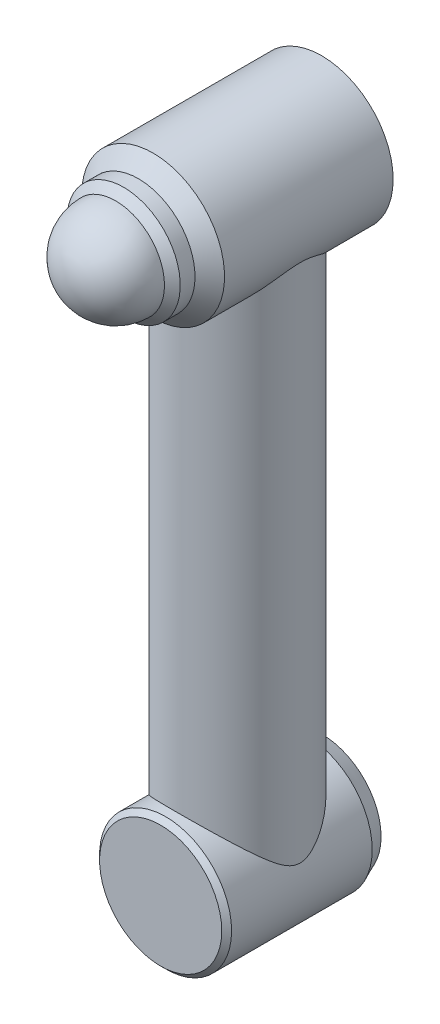
from build123d import *

# Parameters (mm, degrees)
SKETCH1_R                = 72.5
BOSS_EXTRUDE1_DEPTH      = 294
FILLET1_R                = 72.5
SKETCH2_R                = 63.5
BOSS_EXTRUDE2_DEPTH      = 584.2
BOSS_EXTRUDE3_DEPTH      = 78
BOSS_EXTRUDE3_DEPTH_BACK = 85.75
SKETCH3_R                = 67
CHAMFER1_SIZE            = 5
CHAMFER2_SIZE            = 7
CHAMFER2_SIZE2           = 16
SHELL1_3_OUTLINE_W       = 53.5
SHELL1_3_OUTLINE_H       = 532.228338498


with BuildPart() as part:
    # Sketch1 → Boss-Extrude1 (new body)
    with BuildSketch(Plane.XY):
        Circle(SKETCH1_R)
    extrude(amount=BOSS_EXTRUDE1_DEPTH)

    # Fillet1
    fillet1_edges = [part.edges().sort_by_distance(p)[0] for p in [
        (-72.5, 0, 294),
    ]]
    fillet(fillet1_edges, radius=FILLET1_R)

    # Sketch2 → Boss-Extrude2 (add)
    with BuildSketch(Plane(origin=(0, 0, 0), x_dir=(1, 0, 0), z_dir=(0, 1, 0))):
        with Locations(Location((0, -85.5, 0), (0, 0, 270))):
            Circle(SKETCH2_R)
    extrude(amount=-BOSS_EXTRUDE2_DEPTH)

    # Sketch3 → Boss-Extrude3 (add, two sides: drawn at the far end of the back side and taken through both)
    with BuildSketch(Plane.XY.offset(85.5).offset(-BOSS_EXTRUDE3_DEPTH_BACK)):
        with Locations((0, -584.2)):
            Circle(SKETCH3_R)
    extrude(amount=BOSS_EXTRUDE3_DEPTH + BOSS_EXTRUDE3_DEPTH_BACK)

    # Chamfer1
    chamfer1_edges = [part.edges().sort_by_distance(p)[0] for p in [
        (-67, -584.2, 163.5),
    ]]
    chamfer(chamfer1_edges, length=CHAMFER1_SIZE)

    # Chamfer2
    chamfer2_edges = [part.edges().sort_by_distance(p)[0] for p in [
        (-67, -584.2, -0.25),
    ]]
    chamfer2_side = [part.faces().sort_by_distance(p)[0] for p in [
        (0, -584.2, -0.25),
    ]]
    chamfer(chamfer2_edges, length=CHAMFER2_SIZE, length2=CHAMFER2_SIZE2, reference=chamfer2_side[0])

    # Sketch4 → Cut-Revolve1 (revolve, cut)
    with BuildSketch(Plane(origin=(0, 0, 0), x_dir=(1, 0, 0), z_dir=(0, 1, 0)), mode=Mode.PRIVATE) as cut_revolve1_sk:
        with BuildLine():
            Line((81.109243283, -151.148251361), (72.5, -151.148251361))
            Line((72.5, -151.148251361), (72.5, -171.148251361))
            Line((72.5, -171.148251361), (57.5, -186.148251361))
            Line((57.5, -186.148251361), (57.5, -201.148251361))
            Line((57.5, -201.148251361), (49.5, -209.148251361))
            ThreePointArc((49.5, -209.148251361), (35.001785669, -244.15003703), (0, -258.648251361))
            Line((0, -258.648251361), (0, -319.881343941))
            Line((0, -319.881343941), (156.304849296, -319.881343941))
            Line((156.304849296, -319.881343941), (156.304849296, -151.148251361))
            Line((156.304849296, -151.148251361), (81.109243283, -151.148251361))
        make_face()
    revolve(cut_revolve1_sk.sketch.rotate(Axis((0, 0, 258.648251361), (0, 0, 1)), 180), axis=Axis((0, 0, 258.648251361), (0, 0, 1)), mode=Mode.SUBTRACT)

    # Shell1: read off the stored shape, not the designer's step
    # Shell1 outline → Shell1 (revolve, cut)
    with BuildSketch(Plane.XZ.offset(584.2)):
        Polygon((49.084844252, -0.25), (57, 17.841784567), (57, 153.5), (0, 153.5), (0, -0.25), align=None)
    revolve(axis=Axis((0, -584.2, 0), (0, 0, 1)), mode=Mode.SUBTRACT)

    # Shell1 2 outline → Shell1 2 (revolve, cut)
    with BuildSketch(Plane.XZ):
        with BuildLine():
            Line((62.5, 0), (62.5, 167.006115737))
            Line((62.5, 167.006115737), (47.5, 182.006115737))
            Line((47.5, 182.006115737), (47.5, 197.006115737))
            Line((47.5, 197.006115737), (39.302538652, 205.203577042))
            ThreePointArc((39.302538652, 205.203577042), (29.292188682, 235.647641584), (0, 248.648251361))
            Line((0, 248.648251361), (0, 0))
            Line((0, 0), (62.5, 0))
        make_face()
    revolve(axis=Axis((0, 0, 0), (0, 0, 1)), mode=Mode.SUBTRACT)

    # Shell1 3 outline → Shell1 3 (revolve, cut)
    with BuildSketch(Plane.XY.offset(85.5)):
        with Locations((26.75, -298.423797413)):
            Rectangle(SHELL1_3_OUTLINE_W, SHELL1_3_OUTLINE_H)
    revolve(axis=Axis((0, 0, 85.5), (0, 1, 0)), mode=Mode.SUBTRACT)


solid = part.part
